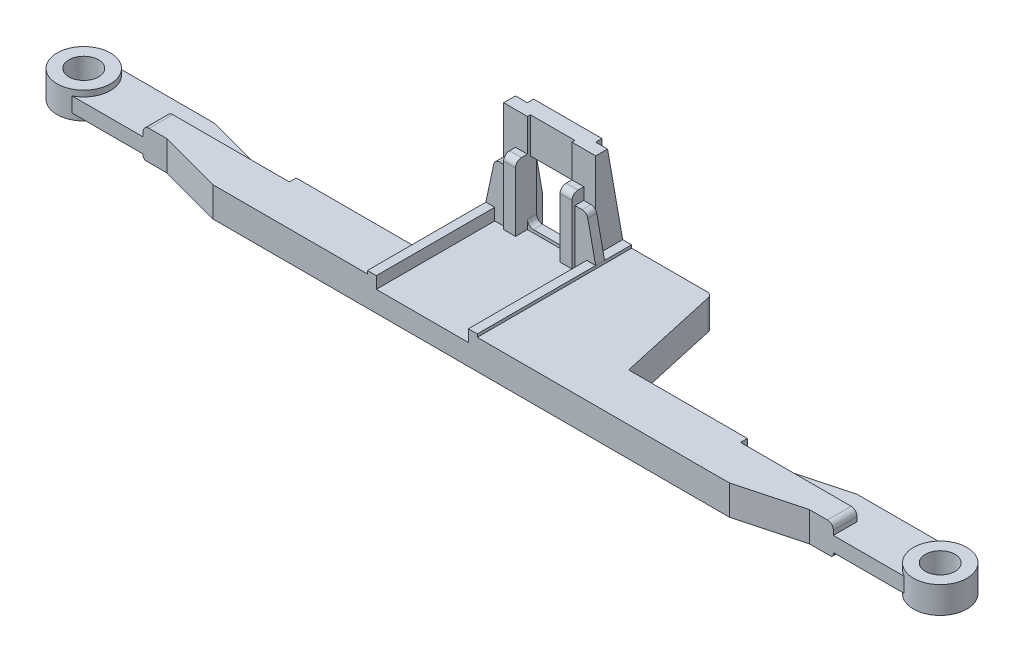
from build123d import *

# Parameters (mm, degrees)
SCHIZZO1_R                        = 2.5
ESTRUSIONE_ESTRUSIONE1_DEPTH      = 1.25
SCHIZZO2_R                        = 4.5
SCHIZZO2_R_2                      = 2.5
ESTRUSIONE_ESTRUSIONE2_DEPTH      = 2.25
ESTRUSIONE_ESTRUSIONE3_DEPTH      = 3
ESTRUSIONE_ESTRUSIONE3_DEPTH_BACK = 2
RACCORDO1_R                       = 1
RACCORDO2_R                       = 1
SCHIZZO8_W                        = 1.5
SCHIZZO8_H                        = 26
ESTRUSIONE_ESTRUSIONE4_DEPTH      = 0.5
SCHIZZO9_W                        = 1.5
SCHIZZO9_H                        = 26
ESTRUSIONE_ESTRUSIONE5_DEPTH      = 0.5
SCHIZZO10_W                       = 15.5
SCHIZZO10_H                       = 26
TAGLIO_ESTRUSIONE1_DEPTH          = 1.5
ESTRUSIONE_ESTRUSIONE6_DEPTH      = 2
ESTRUSIONE_ESTRUSIONE7_DEPTH      = 2
ESTRUSIONE_ESTRUSIONE8_DEPTH      = 11.5
SCHIZZO16_W                       = 7.5
SCHIZZO16_H                       = 6
TAGLIO_ESTRUSIONE2_DEPTH          = 0.5
TAGLIO_ESTRUSIONE3_DEPTH          = 82.579606421
SCHIZZO18_W                       = 2
SCHIZZO18_H                       = 11
ESTRUSIONE_ESTRUSIONE13_DEPTH     = 2
RACCORDO3_R                       = 1
RACCORDO3_OF_SPECCHIA3_R          = 1
ESTRUSIONE_ESTRUSIONE14_DEPTH     = 1.5
RACCORDO4_R                       = 1
RACCORDO4_OF_SPECCHIA4_R          = 1
RACCORDO5_R                       = 0.5
RACCORDO6_R                       = 0.5
SVUOTA1_START                     = -2
SVUOTA1_DEPTH                     = 4
SVUOTA1_2_DEPTH                   = 2.5
SVUOTA1_START_2                   = -0.25
SVUOTA1_3_DEPTH                   = 0.5
SVUOTA1_START_3                   = 2
SVUOTA1_4_OUTLINE_W               = 2
SVUOTA1_4_OUTLINE_H               = 1.057961884
SVUOTA1_4_DEPTH                   = 7.5
SVUOTA1_5_OUTLINE_W               = 1.5
SVUOTA1_5_OUTLINE_H               = 4.05674122
SVUOTA1_5_DEPTH                   = 0.5
SVUOTA1_START_4                   = -13
SVUOTA1_6_OUTLINE_W               = 4
SVUOTA1_6_OUTLINE_H               = 0.557961884
SVUOTA1_6_DEPTH                   = 9.5
SVUOTA1_START_5                   = -15
SVUOTA1_7_DEPTH                   = 2
SVUOTA1_START_6                   = -3.5
SVUOTA1_8_DEPTH                   = 2
SCHIZZO19_W                       = 11.5
SCHIZZO19_H                       = 2.998779336
TAGLIO_ESTRUSIONE4_DEPTH          = 83.581286238
ESTRUSIONE_ESTRUSIONE17_DEPTH     = 1.5
ESTRUSIONE_ESTRUSIONE19_REACH     = 83.077
SCHIZZO24_W                       = 2
SCHIZZO24_H                       = 2.5
ESTRUSIONE_ESTRUSIONE20_REACH     = 83.077
SCHIZZO25_W                       = 2
SCHIZZO25_H                       = 4
RACCORDO7_R                       = 1


# Read off the part's stored shape, not the designer's step: Svuota1
with BuildPart() as part:
    # Schizzo1 → Estrusione-Estrusione1 (new, symmetric)
    with BuildSketch(Plane(origin=(0, 0, 0), x_dir=(1, 0, 0), z_dir=(0, 1, 0))):
        with BuildLine():
            Line((43.5, 0), (-43.5, 0))
            Line((-43.5, 0), (-54.125184089, 2.847009496))
            Line((-54.125184089, 2.847009496), (-72.125184089, 2.847009496))
            ThreePointArc((-72.125184089, 2.847009496), (-76.125184089, 6.847009496), (-72.125184089, 10.847009496))
            Line((-72.125184089, 10.847009496), (-54.125184089, 10.847009496))
            Line((-54.125184089, 10.847009496), (-43.5, 8))
            Line((-43.5, 8), (43.5, 8))
            Line((43.5, 8), (54.125184089, 10.847009496))
            Line((54.125184089, 10.847009496), (72.125184089, 10.847009496))
            ThreePointArc((72.125184089, 10.847009496), (76.125184089, 6.847009496), (72.125184089, 2.847009496))
            Line((72.125184089, 2.847009496), (54.125184089, 2.847009496))
            Line((54.125184089, 2.847009496), (43.5, 0))
        make_face()
        with Locations(Location((-72.125184089, 6.847009496, 0), (0, 0, 270))):
            Circle(SCHIZZO1_R, mode=Mode.SUBTRACT)
        with Locations(Location((72.125184089, 6.847009496, 0), (0, 0, 270))):
            Circle(SCHIZZO1_R, mode=Mode.SUBTRACT)
    extrude(amount=ESTRUSIONE_ESTRUSIONE1_DEPTH, both=True)

    # Schizzo2 → Estrusione-Estrusione2 (add, symmetric)
    with BuildSketch(Plane(origin=(0, 0, 0), x_dir=(1, 0, 0), z_dir=(0, 1, 0))):
        with Locations(Location((-72.125184089, 6.847009496, 0), (0, 0, 270))):
            Circle(SCHIZZO2_R)
        with Locations(Location((-72.125184089, 6.847009496, 0), (0, 0, 270))):
            Circle(SCHIZZO2_R_2, mode=Mode.SUBTRACT)
    estrusione_estrusione2 = extrude(amount=ESTRUSIONE_ESTRUSIONE2_DEPTH, both=True)

    # Specchia1: Estrusione-Estrusione2 across plane
    add(estrusione_estrusione2.mirror(Plane(origin=(0, 0, 0), x_dir=(0, 0, 1), z_dir=(1, 0, 0))))

    # Schizzo7 → Estrusione-Estrusione3 (add, two sides: drawn at the far end of the back side and taken through both)
    with BuildSketch(Plane(origin=(0, 0, 0), x_dir=(1, 0, 0), z_dir=(0, 1, 0)).offset(-ESTRUSIONE_ESTRUSIONE3_DEPTH_BACK)):
        Polygon((-17.5, 8), (-17.5, 26), (14.5, 26), (18.5, 8), (38.5, 8), (38.5, 6.847009496), (58.125184089, 6.847009496), (58.125184089, 2.847009496), (54.125184089, 2.847009496), (43.5, 0), (-43.5, 0), (-54.125184089, 2.847009496), (-58.125184089, 2.847009496), (-58.125184089, 6.847009496), (-37.5, 6.847009496), (-37.5, 8), align=None)
    extrude(amount=ESTRUSIONE_ESTRUSIONE3_DEPTH + ESTRUSIONE_ESTRUSIONE3_DEPTH_BACK)

    # Raccordo1
    raccordo1_edges = [part.edges().sort_by_distance(p)[0] for p in [
        (-58.125184089, 3, -4.847009496),
    ]]
    fillet(raccordo1_edges, radius=RACCORDO1_R)

    # Raccordo2
    raccordo2_edges = [part.edges().sort_by_distance(p)[0] for p in [
        (58.125184089, 3, -4.847009496),
    ]]
    fillet(raccordo2_edges, radius=RACCORDO2_R)

    # Schizzo8 → Estrusione-Estrusione4 (add)
    with BuildSketch(Plane(origin=(0, 3, 0), x_dir=(1, 0, 0), z_dir=(0, 1, 0))):
        with Locations((-16.75, 13)):
            Rectangle(SCHIZZO8_W, SCHIZZO8_H)
    extrude(amount=ESTRUSIONE_ESTRUSIONE4_DEPTH)

    # Schizzo9 → Estrusione-Estrusione5 (add)
    with BuildSketch(Plane(origin=(0, 3, 0), x_dir=(1, 0, 0), z_dir=(0, 1, 0))):
        with Locations((0.25, 13)):
            Rectangle(SCHIZZO9_W, SCHIZZO9_H)
    extrude(amount=ESTRUSIONE_ESTRUSIONE5_DEPTH)

    # Schizzo10 → Taglio-Estrusione1 (cut)
    with BuildSketch(Plane(origin=(0, 3, 0), x_dir=(1, 0, 0), z_dir=(0, 1, 0))):
        with Locations((-8.25, 13)):
            Rectangle(SCHIZZO10_W, SCHIZZO10_H)
    extrude(amount=-TAGLIO_ESTRUSIONE1_DEPTH, mode=Mode.SUBTRACT)

    # Schizzo11 → Estrusione-Estrusione6 (add)
    with BuildSketch(Plane(origin=(-16, 0, 0), x_dir=(0, 0, -1), z_dir=(1, 0, 0))):
        Polygon((26, 1.5), (26, 3.5), (23.44325878, 18), (21.44325878, 18), (21.44325878, 1.5), align=None)
    extrude(amount=ESTRUSIONE_ESTRUSIONE6_DEPTH)

    # Schizzo12 → Estrusione-Estrusione7 (add)
    with BuildSketch(Plane.ZY.offset(0.5)):
        Polygon((-26, 1.5), (-26, 3.5), (-23.44325878, 18), (-21.44325878, 18), (-21.44325878, 1.5), align=None)
    extrude(amount=ESTRUSIONE_ESTRUSIONE7_DEPTH)

    # Schizzo15 → Estrusione-Estrusione8 (add)
    with BuildSketch(Plane.ZY.offset(2.5)):
        Polygon((-21.44325878, 1.5), (-23.001220664, 1.5), (-23.001220664, 12), (-24.501220664, 12), (-24.501220664, 18), (-23.44325878, 18), (-21.44325878, 18), align=None)
    extrude(amount=ESTRUSIONE_ESTRUSIONE8_DEPTH)

    # Schizzo16 → Taglio-Estrusione2 (cut)
    with BuildSketch(Plane.XY.offset(-21.44325878)):
        with Locations((-8.25, 15)):
            Rectangle(SCHIZZO16_W, SCHIZZO16_H)
    extrude(amount=-TAGLIO_ESTRUSIONE2_DEPTH, mode=Mode.SUBTRACT)

    # Schizzo17 → Taglio-Estrusione3 (cut, through all)
    with BuildSketch(Plane.XY.offset(-21.44325878)):
        with BuildLine():
            Line((-12, 12), (-4.5, 12))
            Line((-4.5, 12), (-4.5, 3))
            ThreePointArc((-4.5, 3), (-4.792893219, 2.292893219), (-5.5, 2))
            Line((-5.5, 2), (-11, 2))
            ThreePointArc((-11, 2), (-11.707106781, 2.292893219), (-12, 3))
            Line((-12, 3), (-12, 12))
        make_face()
    extrude(amount=-TAGLIO_ESTRUSIONE3_DEPTH, mode=Mode.SUBTRACT)

    # Schizzo18 → Estrusione-Estrusione13 (add)
    with BuildSketch(Plane.XY.offset(-21.44325878)):
        with Locations((-13, 7)):
            Rectangle(SCHIZZO18_W, SCHIZZO18_H)
    estrusione_estrusione13 = extrude(amount=ESTRUSIONE_ESTRUSIONE13_DEPTH)

    # Raccordo3
    raccordo3_edges = [part.edges().sort_by_distance(p)[0] for p in [
        (-13, 12.5, -19.44325878),
    ]]
    fillet(raccordo3_edges, radius=RACCORDO3_R)

    # Specchia3: Estrusione-Estrusione13 across plane
    add(estrusione_estrusione13.mirror(Plane(origin=(-8.25, 0, 0), x_dir=(0, 0, 1), z_dir=(1, 0, 0))))

    # Raccordo3 of Specchia3
    raccordo3_of_specchia3_edges = [part.edges().sort_by_distance(p)[0] for p in [
        (-3.5, 12.5, -19.44325878),
    ]]
    fillet(raccordo3_of_specchia3_edges, radius=RACCORDO3_OF_SPECCHIA3_R)

    # Schizzo3D2 → Estrusione-Estrusione14 (add)
    with BuildSketch(Plane(origin=(-14, 10.5, -21.44325878), x_dir=(-0.2169304578186563, -0.9761870601839527, 0), z_dir=(0, 0, 1))):
        Polygon((0, 0), (0.433860916, -1.95237412), (7.592566024, -1.898141506), (7.267170337, -0.433860916), (9.219544457, 0), (8.785683542, 1.95237412), align=None)
    estrusione_estrusione14 = extrude(amount=ESTRUSIONE_ESTRUSIONE14_DEPTH)

    # Raccordo4
    # the kernel refuses this fillet: 1 mm, written as the material it takes off along each edge
    with BuildSketch(Plane(origin=(-16, 10.5, -21.44325878), x_dir=(1, 0, 0), z_dir=(0, 0, 1))) as raccordo4_piece_1:
        with BuildLine():
            CenterArc((RACCORDO4_R * 0.808415790234, -RACCORDO4_R), RACCORDO4_R, 90, 77.905242923)
            Line((-RACCORDO4_R * 0.169386623843, -RACCORDO4_R * 0.790470911269), (0, 0))
            Line((0, 0), (RACCORDO4_R * 0.808415790234, 0))
        make_face()
    extrude(amount=3.521039476, mode=Mode.SUBTRACT)

    # Specchia4: Estrusione-Estrusione14 across plane
    add(estrusione_estrusione14.mirror(Plane(origin=(-8.25, 0, 0), x_dir=(0, 0, 1), z_dir=(1, 0, 0))))

    # Raccordo4 of Specchia4
    # the kernel refuses this fillet: 1 mm, written as the material it takes off along each edge
    with BuildSketch(Plane(origin=(-0.5, 10.5, -21.44325878), x_dir=(-1, 0, 0), z_dir=(0, 0, 1))) as raccordo4_of_specchia4_piece_1:
        with BuildLine():
            CenterArc((RACCORDO4_OF_SPECCHIA4_R * 0.808415790234, RACCORDO4_OF_SPECCHIA4_R), RACCORDO4_OF_SPECCHIA4_R, 192.094757077, 77.905242923)
            Line((-RACCORDO4_OF_SPECCHIA4_R * 0.169386623843, RACCORDO4_OF_SPECCHIA4_R * 0.790470911269), (0, 0))
            Line((0, 0), (RACCORDO4_OF_SPECCHIA4_R * 0.808415790234, 0))
        make_face()
    extrude(amount=3.521039476, mode=Mode.SUBTRACT)

    # Raccordo5
    raccordo5_edges = [part.edges().sort_by_distance(p)[0] for p in [
        (58.125184089, -2, -4.847009496),
    ]]
    fillet(raccordo5_edges, radius=RACCORDO5_R)

    # Raccordo6
    raccordo6_edges = [part.edges().sort_by_distance(p)[0] for p in [
        (-58.125184089, -2, -4.847009496),
    ]]
    fillet(raccordo6_edges, radius=RACCORDO6_R)

    # Svuota1 outline → Svuota1 (cut)
    with BuildSketch(Plane(origin=(0, 0, 0), x_dir=(1, 0, 0), z_dir=(0, 1, 0)).offset(SVUOTA1_START)):
        Polygon((-3.5, 20.94325878), (0.5, 20.94325878), (0.5, 1), (43.368347502, 1), (53.993531592, 3.847009496), (57.125184089, 3.847009496), (57.125184089, 5.847009496), (37.5, 5.847009496), (37.5, 7), (17.697828394, 7), (13.697828394, 25), (-1.5, 25), (-1.5, 22.001220664), (-3.5, 22.001220664), align=None)
        Polygon((-15, 22.001220664), (-15, 25), (-16.5, 25), (-16.5, 20.94325878), (-13, 20.94325878), (-13, 22.001220664), align=None)
        Polygon((-43.368347502, 1), (-17, 1), (-17, 7), (-36.5, 7), (-36.5, 5.847009496), (-57.125184089, 5.847009496), (-57.125184089, 3.847009496), (-53.993531592, 3.847009496), align=None)
    extrude(amount=SVUOTA1_DEPTH, mode=Mode.SUBTRACT)

    # Svuota1 2 outline → Svuota1 2 (cut)
    with BuildSketch(Plane(origin=(0, 0, 0), x_dir=(1, 0, 0), z_dir=(0, 1, 0)).offset(SVUOTA1_START)):
        Polygon((0.5, 20.94325878), (-3.5, 20.94325878), (-3.5, 22.001220664), (-1.5, 22.001220664), (-1.5, 25), (-15, 25), (-15, 22.001220664), (-13, 22.001220664), (-13, 20.94325878), (-16.5, 20.94325878), (-16.5, 7), (-17, 7), (-17, 1), (0.5, 1), align=None)
    extrude(amount=SVUOTA1_2_DEPTH, mode=Mode.SUBTRACT)

    # Svuota1 3 outline → Svuota1 3 (cut)
    with BuildSketch(Plane(origin=(0, 0, 0), x_dir=(1, 0, 0), z_dir=(0, 1, 0)).offset(SVUOTA1_START_2)):
        with BuildLine():
            Line((43.631652498, 7), (37.5, 7))
            Line((37.5, 7), (37.5, 5.847009496))
            Line((37.5, 5.847009496), (57.125184089, 5.847009496))
            Line((57.125184089, 5.847009496), (57.125184089, 3.847009496))
            Line((57.125184089, 3.847009496), (70.322408451, 3.847009496))
            ThreePointArc((70.322408451, 3.847009496), (68.625184089, 6.847009496), (70.322408451, 9.847009496))
            Line((70.322408451, 9.847009496), (54.256836587, 9.847009496))
            Line((54.256836587, 9.847009496), (43.631652498, 7))
        make_face()
        with BuildLine():
            Line((-36.5, 5.847009496), (-36.5, 7))
            Line((-36.5, 7), (-43.631652498, 7))
            Line((-43.631652498, 7), (-54.256836587, 9.847009496))
            Line((-54.256836587, 9.847009496), (-70.322408451, 9.847009496))
            ThreePointArc((-70.322408451, 9.847009496), (-68.625184089, 6.847009496), (-70.322408451, 3.847009496))
            Line((-70.322408451, 3.847009496), (-57.125184089, 3.847009496))
            Line((-57.125184089, 3.847009496), (-57.125184089, 5.847009496))
            Line((-57.125184089, 5.847009496), (-36.5, 5.847009496))
        make_face()
    extrude(amount=SVUOTA1_3_DEPTH, mode=Mode.SUBTRACT)

    # Svuota1 4 outline → Svuota1 4 (cut)
    with BuildSketch(Plane(origin=(0, 0, 0), x_dir=(1, 0, 0), z_dir=(0, 1, 0)).offset(SVUOTA1_START_3)):
        with Locations((-2.5, 21.472239722)):
            Rectangle(SVUOTA1_4_OUTLINE_W, SVUOTA1_4_OUTLINE_H)
        with Locations((-14, 21.472239722)):
            Rectangle(SVUOTA1_4_OUTLINE_W, SVUOTA1_4_OUTLINE_H)
    extrude(amount=SVUOTA1_4_DEPTH, mode=Mode.SUBTRACT)

    # Svuota1 5 outline → Svuota1 5 (cut)
    with BuildSketch(Plane(origin=(0, 0, 0), x_dir=(1, 0, 0), z_dir=(0, 1, 0)).offset(SVUOTA1_START_3)):
        with Locations((-0.75, 22.97162939)):
            Rectangle(SVUOTA1_5_OUTLINE_W, SVUOTA1_5_OUTLINE_H)
        with Locations((-15.75, 22.97162939)):
            Rectangle(SVUOTA1_5_OUTLINE_W, SVUOTA1_5_OUTLINE_H)
    extrude(amount=SVUOTA1_5_DEPTH, mode=Mode.SUBTRACT)

    # Svuota1 6 outline → Svuota1 6 (cut)
    with BuildSketch(Plane.YZ.offset(SVUOTA1_START_4)):
        with Locations((15, -23.222239722)):
            Rectangle(SVUOTA1_6_OUTLINE_W, SVUOTA1_6_OUTLINE_H)
    extrude(amount=SVUOTA1_6_DEPTH, mode=Mode.SUBTRACT)

    # Svuota1 7 outline → Svuota1 7 (cut)
    with BuildSketch(Plane.YZ.offset(SVUOTA1_START_5)):
        Polygon((17, -22.604159149), (17, -22.44325878), (13, -22.44325878), (13, -23.309467071), align=None)
    extrude(amount=SVUOTA1_7_DEPTH, mode=Mode.SUBTRACT)

    # Svuota1 8 outline → Svuota1 8 (cut)
    with BuildSketch(Plane.YZ.offset(SVUOTA1_START_6)):
        Polygon((17, -22.604159149), (17, -22.44325878), (13, -22.44325878), (13, -23.309467071), align=None)
    extrude(amount=SVUOTA1_8_DEPTH, mode=Mode.SUBTRACT)

    # Schizzo19 → Taglio-Estrusione4 (cut, through all)
    with BuildSketch(Plane(origin=(0, 1.5, 0), x_dir=(1, 0, 0), z_dir=(0, 1, 0))):
        with Locations((-8.25, 24.500610332)):
            Rectangle(SCHIZZO19_W, SCHIZZO19_H)
    extrude(amount=-TAGLIO_ESTRUSIONE4_DEPTH, mode=Mode.SUBTRACT)

    # Schizzo20 → Estrusione-Estrusione17 (add)
    with BuildSketch(Plane(origin=(0, 0, -20.94325878), x_dir=(-1, 0, 0), z_dir=(0, 0, 1))):
        Polygon((16.5, -0.5), (16.5, 2), (8.5, 2), (8.5, 5), (3.5, 5), (3.5, 9), (-3.5, 9), (-3.5, 5), (-9.5, 5), (-9.5, 2), (-15.5, 2), (-15.5, -2), (-0.5, -2), (-0.5, -0.5), align=None)
    extrude(amount=ESTRUSIONE_ESTRUSIONE17_DEPTH)

    # Schizzo24 → Estrusione-Estrusione19 (add, up to next)
    with BuildSketch(Plane.XY.offset(-19.44325878), mode=Mode.PRIVATE) as estrusione_estrusione19_sk1:
        with Locations((-7.5, -0.75)):
            Rectangle(SCHIZZO24_W, SCHIZZO24_H)
    estrusione_estrusione19_tool1 = extrude(estrusione_estrusione19_sk1.sketch, amount=ESTRUSIONE_ESTRUSIONE19_REACH, mode=Mode.PRIVATE) - part.part
    add(estrusione_estrusione19_tool1.solids().sort_by_distance((-7.5, -0.75, -19.443259))[0])

    # Schizzo25 → Estrusione-Estrusione20 (add, up to next)
    with BuildSketch(Plane.XY.offset(-19.44325878), mode=Mode.PRIVATE) as estrusione_estrusione20_sk1:
        with Locations((8.5, 0)):
            Rectangle(SCHIZZO25_W, SCHIZZO25_H)
    estrusione_estrusione20_tool1 = extrude(estrusione_estrusione20_sk1.sketch, amount=ESTRUSIONE_ESTRUSIONE20_REACH, mode=Mode.PRIVATE) - part.part
    add(estrusione_estrusione20_tool1.solids().sort_by_distance((8.5, 0, -19.443259))[0])

    # Raccordo7
    raccordo7_edges = [part.edges().sort_by_distance(p)[0] for p in [
        (14.5, 0.5, -26),
    ]]
    fillet(raccordo7_edges, radius=RACCORDO7_R)


solid = part.part
